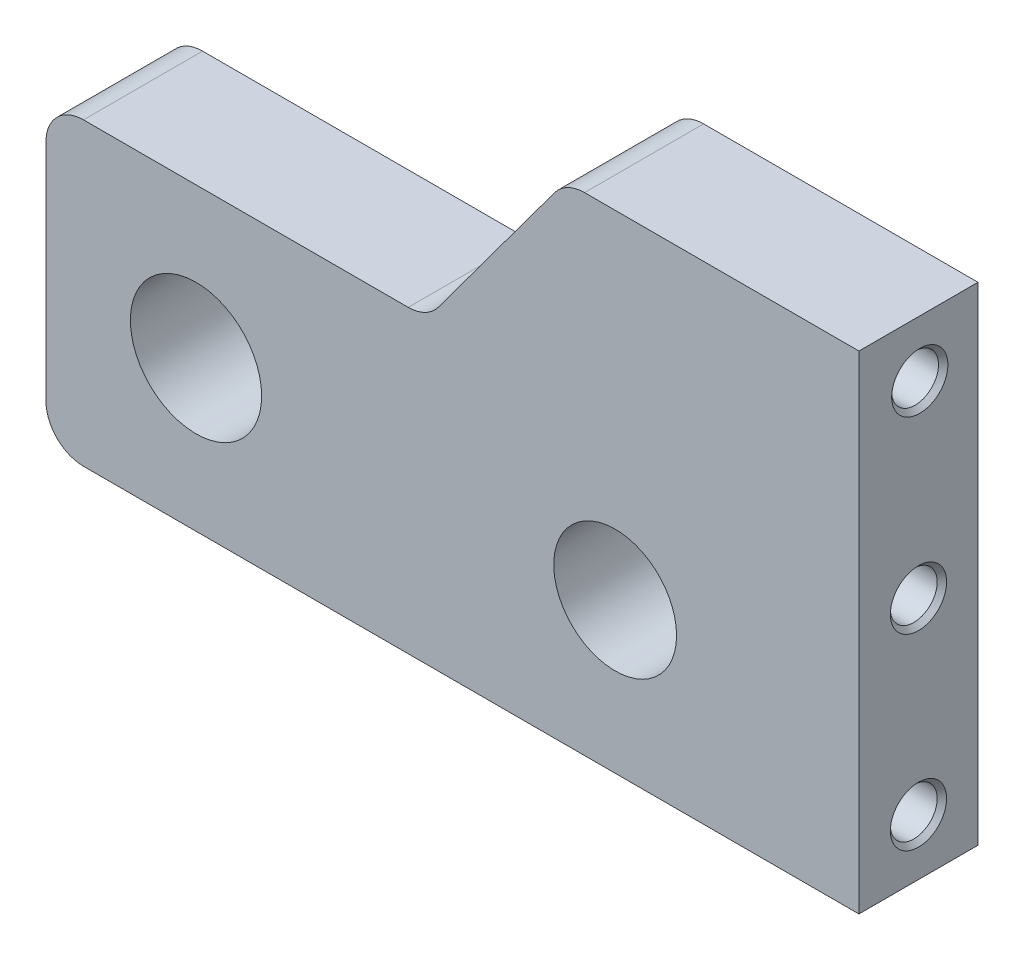
from build123d import *

# Parameters (mm, degrees)
SKETCH1_W           = 43.352
SKETCH1_H           = 16
BOSS_EXTRUDE1_DEPTH = 6.35
SKETCH1_6_R         = 3.275
SKETCH1_6_R_2       = 3.5
CUT_EXTRUDE1_DEPTH  = 6.35
FILLET1_R           = 2
SKETCH2_R           = 1.25
CUT_EXTRUDE2_DEPTH  = 5
BOSS_EXTRUDE2_DEPTH = 6.35
FILLET2_R           = 2
SKETCH4_R           = 1.25
CUT_EXTRUDE3_DEPTH  = 5
CHAMFER1_SIZE       = 0.25


with BuildPart() as part:
    # Sketch1 → Boss-Extrude1 (new body)
    with BuildSketch(Plane.XY):
        with Locations((21.676, 8)):
            Rectangle(SKETCH1_W, SKETCH1_H)
    extrude(amount=BOSS_EXTRUDE1_DEPTH)

    # Sketch1<6> → Cut-Extrude1 (cut)
    with BuildSketch(Plane.XY):
        with Locations((30.352, 8)):
            Circle(SKETCH1_6_R)
        with Locations((8, 8)):
            Circle(SKETCH1_6_R_2)
    extrude(amount=CUT_EXTRUDE1_DEPTH, mode=Mode.SUBTRACT)

    # Fillet1
    fillet1_edges = [part.edges().sort_by_distance(p)[0] for p in [
        (0, 16, 3.175),
        (0, 0, 3.175),
    ]]
    fillet(fillet1_edges, radius=FILLET1_R)

    # Sketch2 → Cut-Extrude2 (cut)
    with BuildSketch(Plane(origin=(43.352, 0, 0), x_dir=(0, 0, -1), z_dir=(1, 0, 0))):
        with Locations((-3.175, 13)):
            Circle(SKETCH2_R)
        with Locations((-3.175, 3)):
            Circle(SKETCH2_R)
    extrude(amount=-CUT_EXTRUDE2_DEPTH, mode=Mode.SUBTRACT)

    # Sketch3 → Boss-Extrude2 (add)
    with BuildSketch(Plane.XY.offset(6.35)):
        Polygon((20.326281713, 16), (43.352, 16), (43.352, 26), (27.712043107, 26), align=None)
    extrude(amount=-BOSS_EXTRUDE2_DEPTH)

    # Fillet2
    fillet2_edges = [part.edges().sort_by_distance(p)[0] for p in [
        (20.326281713, 16, 3.175),
        (27.712043107, 26, 3.175),
    ]]
    fillet(fillet2_edges, radius=FILLET2_R)

    # Sketch4 → Cut-Extrude3 (cut)
    with BuildSketch(Plane(origin=(43.352, 0, 0), x_dir=(0, 0, -1), z_dir=(1, 0, 0))):
        with Locations((-3.10572404, 23)):
            Circle(SKETCH4_R)
    extrude(amount=-CUT_EXTRUDE3_DEPTH, mode=Mode.SUBTRACT)

    # Chamfer1
    chamfer1_edges = [part.edges().sort_by_distance(p)[0] for p in [
        (43.352, 3, 4.425),
        (43.352, 13, 4.425),
        (43.352, 23, 4.35572404),
    ]]
    chamfer(chamfer1_edges, length=CHAMFER1_SIZE)


solid = part.part
